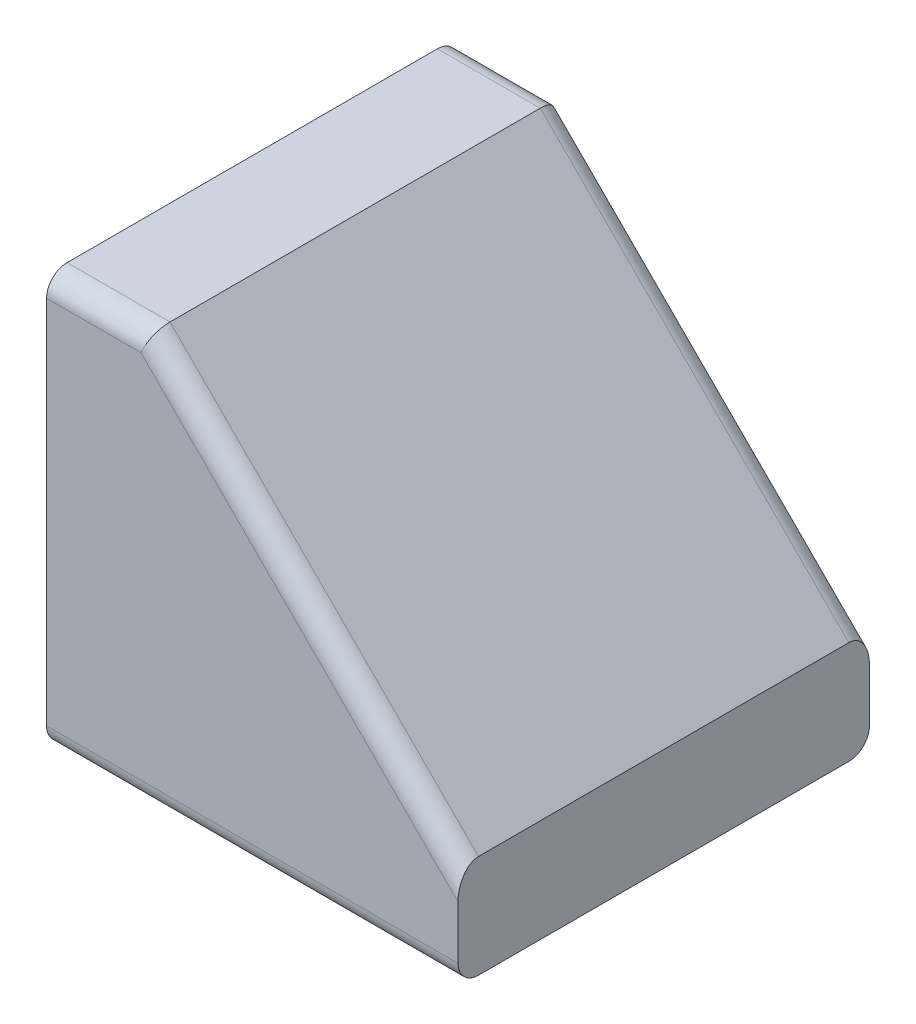
from build123d import *

# Parameters (mm, degrees)
SKETCH1_W           = 20
SKETCH1_H           = 20
BOSS_EXTRUDE1_DEPTH = 20
CHAMFER1_SIZE       = 15
FILLET1_R           = 1
SKETCH2_R           = 2.05
BOSS_EXTRUDE2_DEPTH = 5


with BuildPart() as part:
    # Sketch1 → Boss-Extrude1 (new body)
    with BuildSketch(Plane(origin=(0, 0, 0), x_dir=(1, 0, 0), z_dir=(0, 1, 0))):
        Rectangle(SKETCH1_W, SKETCH1_H)
    extrude(amount=BOSS_EXTRUDE1_DEPTH)

    # Chamfer1
    chamfer1_edges = [part.edges().sort_by_distance(p)[0] for p in [
        (10, 20, 0),
    ]]
    chamfer(chamfer1_edges, length=CHAMFER1_SIZE)

    # Fillet1
    fillet1_edges = [part.edges().sort_by_distance(p)[0] for p in [
        (2.5, 12.5, -10),
        (2.5, 12.5, 10),
        (0, 0, -10),
        (-7.5, 20, -10),
        (0, 0, 10),
        (-7.5, 20, 10),
    ]]
    fillet(fillet1_edges, radius=FILLET1_R)

    # Sketch2 → Boss-Extrude2 (add)
    with BuildSketch(Plane.ZY.offset(10)):
        with Locations((0, 10)):
            Circle(SKETCH2_R)
    extrude(amount=BOSS_EXTRUDE2_DEPTH)


solid = part.part
